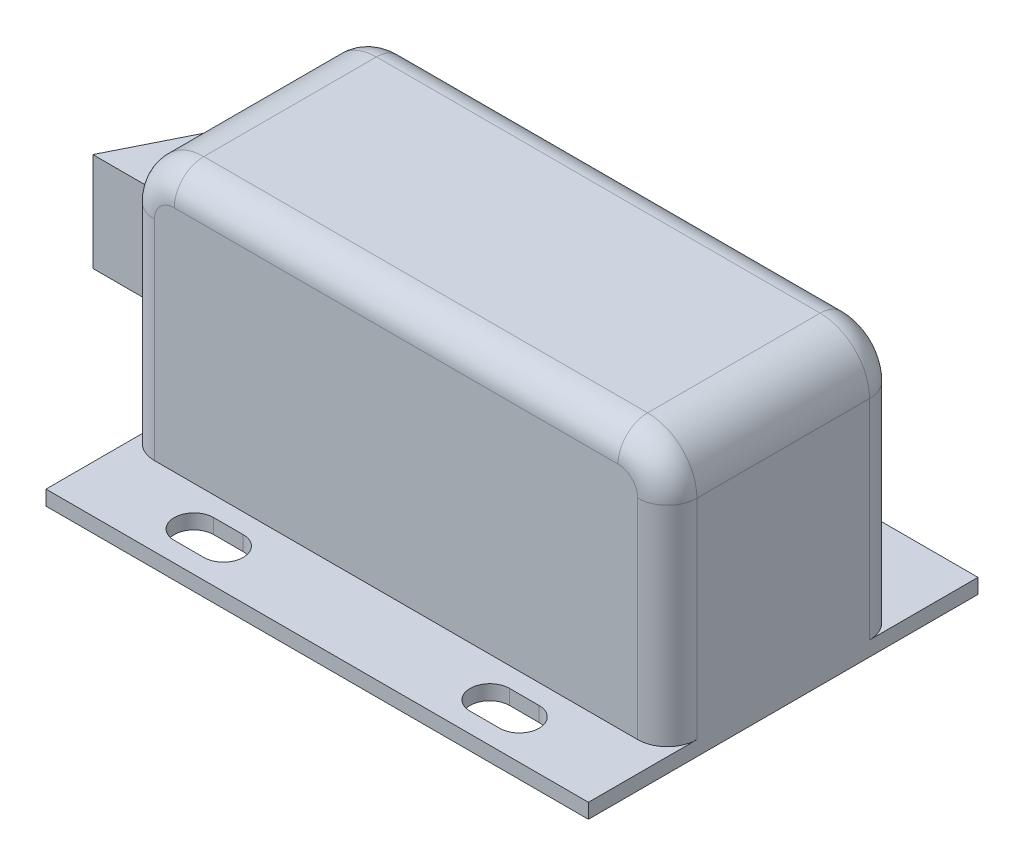
from build123d import *

# Parameters (mm, degrees)
SKETCH1_W           = 55
SKETCH1_H           = 39.5
BOSS_EXTRUDE1_DEPTH = 27.7
SKETCH2_W           = 8
SKETCH2_H           = 26.2
CUT_EXTRUDE1_DEPTH  = 65.877365082
SKETCH3_W           = 8
SKETCH3_H           = 26.2
CUT_EXTRUDE2_DEPTH  = 65.877365082
CUT_EXTRUDE3_DEPTH  = 50.345111207
CUT_EXTRUDE4_DEPTH  = 51.15765146
CUT_EXTRUDE5_DEPTH  = 50.345111207
CUT_EXTRUDE6_DEPTH  = 51.15765146
BOSS_EXTRUDE2_DEPTH = 10
FILLET1_R           = 5
FILLET2_R           = 3


with BuildPart() as part:
    # Sketch1 → Boss-Extrude1 (new body)
    with BuildSketch(Plane(origin=(0, 13.85, 0), x_dir=(1, 0, 0), z_dir=(0, 1, 0))):
        with Locations((0, -11.75)):
            Rectangle(SKETCH1_W, SKETCH1_H)
    extrude(amount=-BOSS_EXTRUDE1_DEPTH)

    # Sketch2 → Cut-Extrude1 (cut, through all)
    with BuildSketch(Plane.ZY.offset(27.5)):
        with Locations((27.5, 0.75)):
            Rectangle(SKETCH2_W, SKETCH2_H)
    extrude(amount=-CUT_EXTRUDE1_DEPTH, mode=Mode.SUBTRACT)

    # Sketch3 → Cut-Extrude2 (cut, through all)
    with BuildSketch(Plane.ZY.offset(27.5)):
        with Locations((-4, 0.75)):
            Rectangle(SKETCH3_W, SKETCH3_H)
    extrude(amount=-CUT_EXTRUDE2_DEPTH, mode=Mode.SUBTRACT)

    # Sketch4 → Cut-Extrude3 (cut, through all)
    with BuildSketch(Plane(origin=(0, -12.35, 0), x_dir=(-1, 0, 0), z_dir=(0, 1, 0))):
        with BuildLine():
            Line((-13.5, -2), (-16.5, -2))
            ThreePointArc((-16.5, -2), (-18.5, -4), (-16.5, -6))
            Line((-16.5, -6), (-13.5, -6))
            ThreePointArc((-13.5, -6), (-11.5, -4), (-13.5, -2))
        make_face()
    extrude(amount=-CUT_EXTRUDE3_DEPTH, mode=Mode.SUBTRACT)

    # Sketch5 → Cut-Extrude4 (cut, through all)
    with BuildSketch(Plane.XZ.offset(13.85)):
        with BuildLine():
            Line((-16.5, -6), (-13.5, -6))
            ThreePointArc((-13.5, -6), (-11.5, -4), (-13.5, -2))
            Line((-13.5, -2), (-16.5, -2))
            ThreePointArc((-16.5, -2), (-18.5, -4), (-16.5, -6))
        make_face()
    extrude(amount=-CUT_EXTRUDE4_DEPTH, mode=Mode.SUBTRACT)

    # Sketch6 → Cut-Extrude5 (cut, through all)
    with BuildSketch(Plane(origin=(0, -12.35, 0), x_dir=(-1, 0, 0), z_dir=(0, 1, 0))):
        with BuildLine():
            Line((16.5, 29.5), (13.5, 29.5))
            ThreePointArc((13.5, 29.5), (11.5, 27.5), (13.5, 25.5))
            Line((13.5, 25.5), (16.5, 25.5))
            ThreePointArc((16.5, 25.5), (18.5, 27.5), (16.5, 29.5))
        make_face()
    extrude(amount=-CUT_EXTRUDE5_DEPTH, mode=Mode.SUBTRACT)

    # Sketch7 → Cut-Extrude6 (cut, through all)
    with BuildSketch(Plane.XZ.offset(13.85)):
        with BuildLine():
            Line((13.5, 25.5), (16.5, 25.5))
            ThreePointArc((16.5, 25.5), (18.5, 27.5), (16.5, 29.5))
            Line((16.5, 29.5), (13.5, 29.5))
            ThreePointArc((13.5, 29.5), (11.5, 27.5), (13.5, 25.5))
        make_face()
    extrude(amount=-CUT_EXTRUDE6_DEPTH, mode=Mode.SUBTRACT)

    # Sketch8 → Boss-Extrude2 (add)
    with BuildSketch(Plane.XZ.offset(5.35)):
        Polygon((-37.5, 16.75), (-32.5, 6.75), (-27.5, 6.75), (-27.5, 16.75), align=None)
    extrude(amount=-BOSS_EXTRUDE2_DEPTH)

    # Fillet1
    fillet1_edges = [part.edges().sort_by_distance(p)[0] for p in [
        (27.5, 13.85, 11.75),
        (-27.5, 13.85, 11.75),
    ]]
    fillet(fillet1_edges, radius=FILLET1_R)

    # Fillet2
    fillet2_edges = [part.edges().sort_by_distance(p)[0] for p in [
        (27.5, -1.75, 23.5),
        (26.035533906, 12.385533906, 23.5),
        (0, 13.85, 23.5),
        (-26.035533906, 12.385533906, 23.5),
        (-27.5, -1.75, 23.5),
        (-27.5, -1.75, 0),
        (-26.035533906, 12.385533906, 0),
        (0, 13.85, 0),
        (26.035533906, 12.385533906, 0),
        (27.5, -1.75, 0),
    ]]
    fillet(fillet2_edges, radius=FILLET2_R)


solid = part.part
